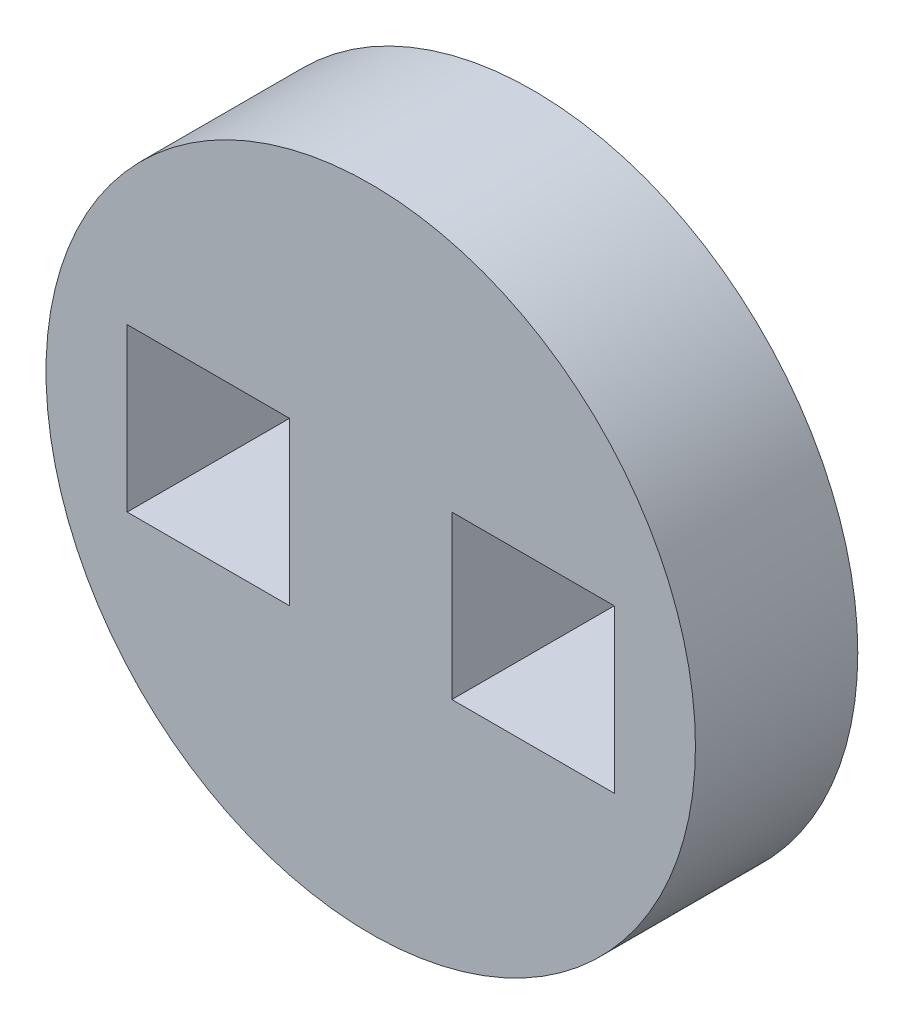
from build123d import *

# Parameters (mm, degrees)
SKETCH1_R           = 6.35
SKETCH1_W           = 3.175
SKETCH1_H           = 3.175
BOSS_EXTRUDE1_DEPTH = 3.175


with BuildPart() as part:
    # Sketch1 → Boss-Extrude1 (new body)
    with BuildSketch(Plane.XY):
        Circle(SKETCH1_R)
        with Locations((3.175, 0)):
            Rectangle(SKETCH1_W, SKETCH1_H, mode=Mode.SUBTRACT)
        with Locations((-3.175, 0)):
            Rectangle(SKETCH1_W, SKETCH1_H, mode=Mode.SUBTRACT)
    extrude(amount=BOSS_EXTRUDE1_DEPTH)


solid = part.part
